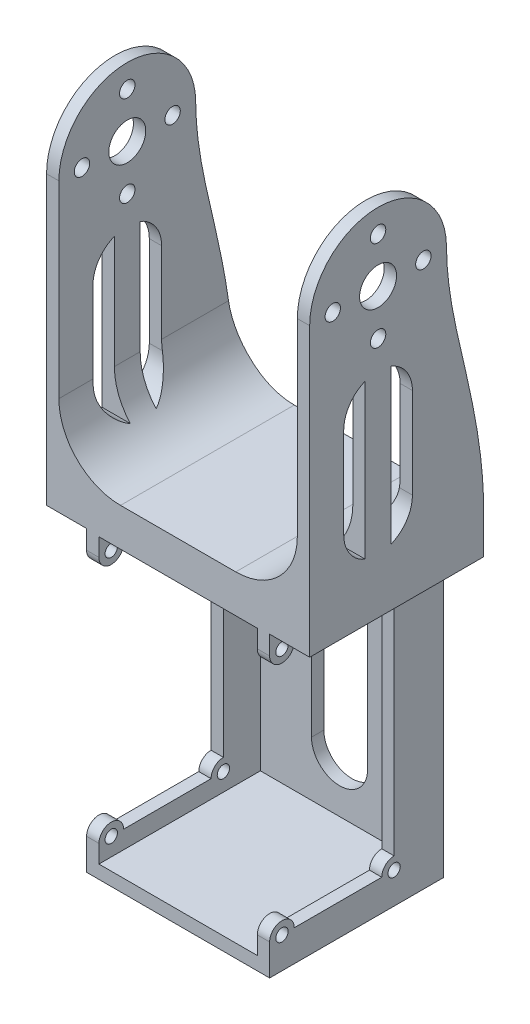
from build123d import *

# Parameters (mm, degrees)
SKETCH_1_W           = 42.7
SKETCH_1_H           = 21
SKETCH_1_R           = 1.5
EXTRUDE_1_DEPTH      = 2
SKETCH_2_R           = 1.25
SKETCH_2_R_2         = 3
EXTRUDE_2_DEPTH      = 2
EXTRUDE_3_DEPTH      = 14.85
EXTRUDE_3_DEPTH_BACK = 14.85
SKETCH_3_R           = 1
SKETCH_4_R           = 1.25
SKETCH_4_R_2         = 3
EXTRUDE_5_DEPTH      = 2
SKETCH_5_W           = 38.7
SKETCH_5_H           = 6
EXTRUDE_7_DEPTH      = 22.2
FILLET_START         = -11.1
FILLET_1_DEPTH       = 22.2
FILLET_START_2       = -19.35
FILLET_1_2_DEPTH     = 38.7
SKETCH_7_R           = 1
EXTRUDE_9_DEPTH      = 29.7
EXTRUDE_10_DEPTH     = 2
CUT_EXTRUDE_2_DEPTH  = 26.2
SKETCH_10_W          = 29.7
SKETCH_10_H          = 28.2
EXTRUDE_11_DEPTH     = 2
EXTRUDE_START        = 6
EXTRUDE_12_DEPTH     = 6
CUT_EXTRUDE_START    = -42.7
CUT_EXTRUDE_3_DEPTH  = 42.7
CUT_EXTRUDE_4_DEPTH  = 2


with BuildPart() as part:
    # 草图1 → 凸台-拉伸1 (new body)
    with BuildSketch(Plane(origin=(0, 0, 0), x_dir=(1, 0, 0), z_dir=(0, 1, 0))):
        Rectangle(SKETCH_1_W, SKETCH_1_H)
        with Locations(Location((7.5, 5, 0), (0, 0, 270))):
            Circle(SKETCH_1_R, mode=Mode.SUBTRACT)
        with Locations(Location((7.5, -5, 0), (0, 0, 90))):
            Circle(SKETCH_1_R, mode=Mode.SUBTRACT)
        with Locations(Location((-7.5, -5, 0), (0, 0, 270))):
            Circle(SKETCH_1_R, mode=Mode.SUBTRACT)
        with Locations(Location((-7.5, 5, 0), (0, 0, 90))):
            Circle(SKETCH_1_R, mode=Mode.SUBTRACT)
        with BuildLine():
            Line((8.017950723, 1.550908082), (12.912587519, 1.550908082))
            ThreePointArc((12.912587519, 1.550908082), (14.126270768, 1.145131224), (14.697546856, 0))
            ThreePointArc((14.697546856, 0), (14.126270768, -1.145131224), (12.912587519, -1.550908082))
            Line((12.912587519, -1.550908082), (8.017950723, -1.550908082))
            add(Edge.make_bspline(
                [(0, -7.407271614), (2.092471107, -7.358009404), (3.043739342, -2.951912586), (6.007732496, -1.626733157), (8.017950723, -1.550908082)],
                knots=[0, 0, 0, 0, 0.496822763, 1, 1, 1, 1], degree=3))
            add(Edge.make_bspline(
                [(0, -7.407271614), (-2.092471107, -7.358009404), (-3.043739342, -2.951912586), (-6.007732496, -1.626733157), (-8.017950723, -1.550908082)],
                knots=[0, 0, 0, 0, 0.496822763, 1, 1, 1, 1], degree=3))
            Line((-8.017950723, -1.550908082), (-12.912587519, -1.550908082))
            ThreePointArc((-12.912587519, -1.550908082), (-14.126270768, -1.145131224), (-14.697546856, 0))
            ThreePointArc((-14.697546856, 0), (-14.126270768, 1.145131224), (-12.912587519, 1.550908082))
            Line((-12.912587519, 1.550908082), (-8.017950723, 1.550908082))
            add(Edge.make_bspline(
                [(0, 7.407271614), (-2.092471107, 7.358009404), (-3.043739342, 2.951912586), (-6.007732496, 1.626733157), (-8.017950723, 1.550908082)],
                knots=[0, 0, 0, 0, 0.496822763, 1, 1, 1, 1], degree=3))
            add(Edge.make_bspline(
                [(0, 7.407271614), (2.092471107, 7.358009404), (3.043739342, 2.951912586), (6.007732496, 1.626733157), (8.017950723, 1.550908082)],
                knots=[0, 0, 0, 0, 0.496822763, 1, 1, 1, 1], degree=3))
        make_face(mode=Mode.SUBTRACT)
    extrude(amount=EXTRUDE_1_DEPTH)

    # 草图2 → 凸台-拉伸2 (add)
    with BuildSketch(Plane.ZY.offset(21.35)):
        with BuildLine():
            Line((-10.5, 2), (-10.5, 46))
            ThreePointArc((-10.5, 46), (0, 56.5), (10.5, 46))
            Line((10.5, 46), (10.5, 2))
            Line((10.5, 2), (-10.5, 2))
        make_face()
        with Locations((0, 38.65)):
            Circle(SKETCH_2_R, mode=Mode.SUBTRACT)
        with Locations((-7.35, 46)):
            Circle(SKETCH_2_R, mode=Mode.SUBTRACT)
        with Locations((0, 53.35)):
            Circle(SKETCH_2_R, mode=Mode.SUBTRACT)
        with Locations((7.35, 46)):
            Circle(SKETCH_2_R, mode=Mode.SUBTRACT)
        with Locations((0, 46)):
            Circle(SKETCH_2_R_2, mode=Mode.SUBTRACT)
        with BuildLine():
            Line((-2.091438456, 33.71946821), (-2.091438456, 8.682620376))
            ThreePointArc((-2.091438456, 8.682620376), (-4.622608783, 10.734209017), (-5.574745456, 13.850179963))
            Line((-5.574745456, 13.850179963), (-5.574745456, 28.551908623))
            ThreePointArc((-5.574745456, 28.551908623), (-4.622608783, 31.667879569), (-2.091438456, 33.71946821))
        make_face(mode=Mode.SUBTRACT)
        with BuildLine():
            Line((5.574745456, 28.551908623), (5.574745456, 13.850179963))
            ThreePointArc((5.574745456, 13.850179963), (4.622608783, 10.734209017), (2.091438456, 8.682620376))
            Line((2.091438456, 8.682620376), (2.091438456, 33.71946821))
            ThreePointArc((2.091438456, 33.71946821), (4.622608783, 31.667879569), (5.574745456, 28.551908623))
        make_face(mode=Mode.SUBTRACT)
    extrude_2 = extrude(amount=-EXTRUDE_2_DEPTH)

    # 镜向1: 凸台-拉伸2 across plane
    add(extrude_2.mirror(Plane(origin=(0, 0, 0), x_dir=(0, 0, 1), z_dir=(1, 0, 0))))

    # 草图3 → 凸台-拉伸3 (add, two sides: drawn at the far end of the back side and taken through both)
    # profile 1 of 2: a face of its own
    with BuildSketch(Plane(origin=(0, 0, 0), x_dir=(0, 0, -1), z_dir=(1, 0, 0)).offset(-EXTRUDE_3_DEPTH_BACK)):
        with BuildLine():
            Line((0, -3.661905735), (0, 0))
            Line((0, 0), (-11.1, 0))
            Line((-11.1, 0), (-11.1, -3.661905735))
            ThreePointArc((-11.1, -3.661905735), (-9.1, -5.661905735), (-7.1, -3.661905735))
            Line((-7.1, -3.661905735), (0, -3.661905735))
        make_face()
        with Locations((-9.1, -3.661905735)):
            Circle(SKETCH_3_R, mode=Mode.SUBTRACT)
    # profile 2 of 2: a face of its own
    with BuildSketch(Plane(origin=(0, 0, 0), x_dir=(0, 0, -1), z_dir=(1, 0, 0)).offset(-EXTRUDE_3_DEPTH_BACK)):
        with BuildLine():
            Line((11.1, 0), (0, 0))
            Line((0, 0), (0, -3.661905735))
            Line((0, -3.661905735), (7.1, -3.661905735))
            ThreePointArc((7.1, -3.661905735), (9.1, -5.661905735), (11.1, -3.661905735))
            Line((11.1, -3.661905735), (11.1, 0))
        make_face()
        with Locations((9.1, -3.661905735)):
            Circle(SKETCH_3_R, mode=Mode.SUBTRACT)
    extrude(amount=EXTRUDE_3_DEPTH + EXTRUDE_3_DEPTH_BACK)

    # 草图4 → 凸台-拉伸5 (add)
    with BuildSketch(Plane.ZY.offset(21.35)):
        with BuildLine():
            Line((-11.1, -0.6), (11.1, -0.6))
            Line((11.1, -0.6), (11.1, 46))
            ThreePointArc((11.1, 46), (0, 57.1), (-11.1, 46))
            Line((-11.1, 46), (-11.1, -0.6))
        make_face()
        with Locations((-7.35, 46)):
            Circle(SKETCH_4_R, mode=Mode.SUBTRACT)
        with Locations((0, 53.35)):
            Circle(SKETCH_4_R, mode=Mode.SUBTRACT)
        with Locations((7.35, 46)):
            Circle(SKETCH_4_R, mode=Mode.SUBTRACT)
        with Locations((0, 38.65)):
            Circle(SKETCH_4_R, mode=Mode.SUBTRACT)
        with Locations((0, 46)):
            Circle(SKETCH_4_R_2, mode=Mode.SUBTRACT)
        with BuildLine():
            Line((-5.574745456, 28.551908623), (-5.574745456, 13.850179963))
            ThreePointArc((-5.574745456, 13.850179963), (-4.622608783, 10.734209017), (-2.091438456, 8.682620376))
            Line((-2.091438456, 8.682620376), (-2.091438456, 33.71946821))
            ThreePointArc((-2.091438456, 33.71946821), (-4.622608783, 31.667879569), (-5.574745456, 28.551908623))
        make_face(mode=Mode.SUBTRACT)
        with BuildLine():
            Line((5.574745456, 13.850179963), (5.574745456, 28.551908623))
            ThreePointArc((5.574745456, 28.551908623), (4.622608783, 31.667879569), (2.091438456, 33.71946821))
            Line((2.091438456, 33.71946821), (2.091438456, 8.682620376))
            ThreePointArc((2.091438456, 8.682620376), (4.622608783, 10.734209017), (5.574745456, 13.850179963))
        make_face(mode=Mode.SUBTRACT)
    extrude_5 = extrude(amount=-EXTRUDE_5_DEPTH)

    # 镜向2: 凸台-拉伸5 across plane
    add(extrude_5.mirror(Plane(origin=(0, 0, 0), x_dir=(0, 0, 1), z_dir=(1, 0, 0))))

    # 草图5 → 凸台-拉伸7 (add)
    with BuildSketch(Plane.XY.offset(11.1)):
        with Locations((0, 2.4)):
            Rectangle(SKETCH_5_W, SKETCH_5_H)
    extrude(amount=-EXTRUDE_7_DEPTH)

    # 圆角1: read off the stored shape, not the designer's step
    # 圆角1 outline → 圆角1 (add)
    with BuildSketch(Plane.XY.offset(FILLET_START)):
        with BuildLine():
            Line((19.35, 5.4), (19.35, 15.4))
            ThreePointArc((19.35, 15.4), (16.421067812, 8.328932188), (9.35, 5.4))
            Line((9.35, 5.4), (19.35, 5.4))
        make_face()
        with BuildLine():
            Line((-19.35, 5.4), (-9.35, 5.4))
            ThreePointArc((-9.35, 5.4), (-16.421067812, 8.328932188), (-19.35, 15.4))
            Line((-19.35, 15.4), (-19.35, 5.4))
        make_face()
    extrude(amount=FILLET_1_DEPTH)

    # Fillet 1 2 outline → Fillet 1 2 (cut)
    with BuildSketch(Plane.YZ.offset(FILLET_START_2)):
        with BuildLine():
            Line((13.850179963, -5.574745456), (15.4, -5.574745456))
            Line((15.4, -5.574745456), (15.4, -2.091438456))
            Line((15.4, -2.091438456), (8.682620376, -2.091438456))
            ThreePointArc((8.682620376, -2.091438456), (10.734209017, -4.622608783), (13.850179963, -5.574745456))
        make_face()
        with BuildLine():
            Line((15.4, 2.091438456), (15.4, 5.574745456))
            Line((15.4, 5.574745456), (13.850179963, 5.574745456))
            ThreePointArc((13.850179963, 5.574745456), (10.734209017, 4.622608783), (8.682620376, 2.091438456))
            Line((8.682620376, 2.091438456), (15.4, 2.091438456))
        make_face()
    extrude(amount=FILLET_1_2_DEPTH, mode=Mode.SUBTRACT)

    # 草图7 → 凸台-拉伸9 (add)
    # profile 1 of 2: a face of its own
    with BuildSketch(Plane(origin=(14.85, 0, 0), x_dir=(0, 0, -1), z_dir=(1, 0, 0))):
        Polygon((15.1, -3.661905735), (11.1, -3.661905735), (11.1, -0.6), (17.1, -0.6), (17.1, -3.661905735), (17.1, -43.861905735), (17.1, -46.92381147), (11.1, -46.92381147), (11.1, -43.861905735), (15.1, -43.861905735), align=None)
    # profile 2 of 2: a face of its own
    with BuildSketch(Plane(origin=(14.85, 0, 0), x_dir=(0, 0, -1), z_dir=(1, 0, 0))):
        with BuildLine():
            ThreePointArc((-11.1, -43.861905735), (-9.1, -41.861905735), (-7.1, -43.861905735))
            Line((-7.1, -43.861905735), (7.1, -43.861905735))
            ThreePointArc((7.1, -43.861905735), (9.1, -41.861905735), (11.1, -43.861905735))
            Line((11.1, -43.861905735), (11.1, -46.92381147))
            Line((11.1, -46.92381147), (-11.1, -46.92381147))
            Line((-11.1, -46.92381147), (-11.1, -43.861905735))
        make_face()
        with Locations((9.1, -43.861905735)):
            Circle(SKETCH_7_R, mode=Mode.SUBTRACT)
        with Locations((-9.1, -43.861905735)):
            Circle(SKETCH_7_R, mode=Mode.SUBTRACT)
    extrude(amount=-EXTRUDE_9_DEPTH)

    # 草图8 → 凸台-拉伸10 (add)
    with BuildSketch(Plane(origin=(14.85, 0, 0), x_dir=(0, 0, -1), z_dir=(1, 0, 0))):
        with BuildLine():
            Line((15.1, -43.861905735), (11.1, -43.861905735))
            ThreePointArc((11.1, -43.861905735), (10.514213562, -42.447692173), (9.1, -41.861905735))
            Line((9.1, -41.861905735), (9.1, -5.661905735))
            ThreePointArc((9.1, -5.661905735), (10.514213562, -5.076119297), (11.1, -3.661905735))
            Line((11.1, -3.661905735), (15.1, -3.661905735))
            Line((15.1, -3.661905735), (15.1, -43.861905735))
        make_face()
    extrude_10 = extrude(amount=-EXTRUDE_10_DEPTH)

    # 镜向3: 凸台-拉伸10 across plane
    add(extrude_10.mirror(Plane(origin=(0, 0, 0), x_dir=(0, 0, 1), z_dir=(1, 0, 0))))

    # 草图9 → 切除-拉伸2 (cut)
    with BuildSketch(Plane.XY.offset(11.1)):
        Polygon((-12.85, -3.661905735), (-12.85, -0.761905735), (12.85, -0.761905735), (12.85, -3.661905735), (12.85, -43.861905735), (12.85, -46.761905735), (-12.85, -46.761905735), (-12.85, -43.861905735), align=None)
    extrude(amount=-CUT_EXTRUDE_2_DEPTH, mode=Mode.SUBTRACT)

    # 草图10 → 凸台-拉伸11 (add)
    with BuildSketch(Plane.XZ.offset(46.92381147)):
        with Locations((0, -3)):
            Rectangle(SKETCH_10_W, SKETCH_10_H)
    extrude(amount=EXTRUDE_11_DEPTH)

    # 草图11 → 凸台-拉伸12 (add)
    with BuildSketch(Plane(origin=(0, 0, -11.1), x_dir=(-1, 0, 0), z_dir=(0, 0, -1)).offset(EXTRUDE_START)):
        with BuildLine():
            Line((-21.35, -0.6), (-14.85, -0.6))
            Line((-14.85, -0.6), (14.85, -0.6))
            Line((14.85, -0.6), (21.35, -0.6))
            Line((21.35, -0.6), (21.35, 46))
            Line((21.35, 46), (19.35, 46))
            Line((19.35, 46), (19.35, 15.4))
            ThreePointArc((19.35, 15.4), (16.421067812, 8.328932188), (9.35, 5.4))
            Line((9.35, 5.4), (-9.35, 5.4))
            ThreePointArc((-9.35, 5.4), (-16.421067812, 8.328932188), (-19.35, 15.4))
            Line((-19.35, 15.4), (-19.35, 46))
            Line((-19.35, 46), (-21.35, 46))
            Line((-21.35, 46), (-21.35, -0.6))
        make_face()
    extrude(amount=-EXTRUDE_12_DEPTH)

    # 草图12 → 切除-拉伸3 (cut)
    with BuildSketch(Plane(origin=(21.35, 0, 0), x_dir=(0, 0, -1), z_dir=(1, 0, 0)).offset(CUT_EXTRUDE_START)):
        with BuildLine():
            Line((11.1, 46), (17.1, 46))
            Line((17.1, 46), (17.1, 7.914245737))
            add(Edge.make_bspline(
                [(11.1, 46), (11.150188541, 39.399545251), (14.445826352, 26.889956336), (16.881629906, 14.255723619), (17.1, 7.914245737)],
                knots=[0, 0, 0, 0, 0.509577652, 1, 1, 1, 1], degree=3))
        make_face()
    extrude(amount=CUT_EXTRUDE_3_DEPTH, mode=Mode.SUBTRACT)

    # 草图13 → 切除-拉伸4 (cut)
    with BuildSketch(Plane(origin=(0, 0, -17.1), x_dir=(-1, 0, 0), z_dir=(0, 0, -1))):
        with BuildLine():
            Line((4.550510282, -6.384707406), (4.550510282, -37.875376222))
            ThreePointArc((4.550510282, -37.875376222), (0, -42.425886504), (-4.550510282, -37.875376222))
            Line((-4.550510282, -37.875376222), (-4.550510282, -6.384707406))
            ThreePointArc((-4.550510282, -6.384707406), (0, -1.834197123), (4.550510282, -6.384707406))
        make_face()
    extrude(amount=-CUT_EXTRUDE_4_DEPTH, mode=Mode.SUBTRACT)


solid = part.part
